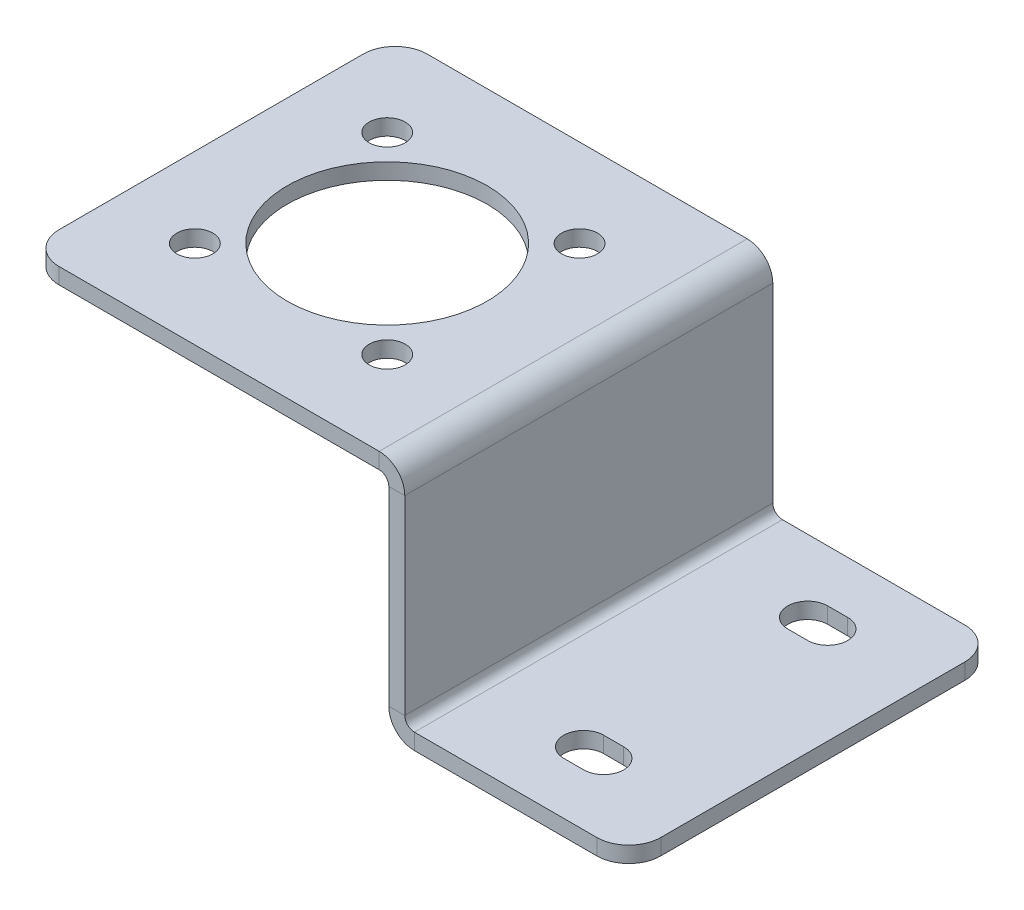
from build123d import *

# Parameters (mm, degrees)
SKETCH1_W          = 44
SKETCH1_H          = 46
SKETCH1_R          = 12.5
SKETCH1_R_2        = 2.25
BASE_FLANGE1_DEPTH = 2
EDGE_FLANGE1_DEPTH = 46
EDGE_FLANGE2_DEPTH = 46
CUT_EXTRUDE1_DEPTH = 2
FILLET1_R          = 4


# Sheet-metal steps are written as plain solids
with BuildPart() as part:
    # Sketch1 → Base-Flange1 (new body)
    with BuildSketch(Plane(origin=(0, 0, 0), x_dir=(1, 0, 0), z_dir=(0, 1, 0))):
        Rectangle(SKETCH1_W, SKETCH1_H)
        with Locations(Location((0, 0, 0), (0, 0, 270))):
            Circle(SKETCH1_R, mode=Mode.SUBTRACT)
        with Locations(Location((12.02081528, 12.02081528, 0), (0, 0, 270))):
            Circle(SKETCH1_R_2, mode=Mode.SUBTRACT)
        with Locations(Location((12.02081528, -12.02081528, 0), (0, 0, 270))):
            Circle(SKETCH1_R_2, mode=Mode.SUBTRACT)
        with Locations(Location((-12.02081528, -12.02081528, 0), (0, 0, 270))):
            Circle(SKETCH1_R_2, mode=Mode.SUBTRACT)
        with Locations(Location((-12.02081528, 12.02081528, 0), (0, 0, 270))):
            Circle(SKETCH1_R_2, mode=Mode.SUBTRACT)
    extrude(amount=-BASE_FLANGE1_DEPTH)

    # Edge-Flange1 section (across the edge) → Edge-Flange1 (add)
    with BuildSketch(Plane(origin=(23.2, -2, -23), x_dir=(-1, 0, 0), z_dir=(0, 0, 1))):
        with BuildLine():
            Line((-2, 1.2), (-2, 25))
            Line((-2, 25), (0, 25))
            Line((0, 25), (0, 1.2))
            ThreePointArc((0, 1.2), (0.351471863, 0.351471863), (1.2, 0))
            Line((1.2, 0), (1.2, -2))
            ThreePointArc((1.2, -2), (-1.0627417, -1.0627417), (-2, 1.2))
        make_face()
    extrude(amount=EDGE_FLANGE1_DEPTH)

    # Edge-Flange2 section (across the edge) → Edge-Flange2 (add)
    with BuildSketch(Plane(origin=(25.2, -28.2, 23), x_dir=(0, 1, 0), z_dir=(0, 0, -1))):
        with BuildLine():
            Line((-2, 1.2), (-2, 28))
            Line((-2, 28), (0, 28))
            Line((0, 28), (0, 1.2))
            ThreePointArc((0, 1.2), (0.351471863, 0.351471863), (1.2, 0))
            Line((1.2, 0), (1.2, -2))
            ThreePointArc((1.2, -2), (-1.0627417, -1.0627417), (-2, 1.2))
        make_face()
    extrude(amount=EDGE_FLANGE2_DEPTH)

    # Sketch12 → Cut-Extrude1 (cut)
    with BuildSketch(Plane(origin=(0, -28.2, 0), x_dir=(1, 0, 0), z_dir=(0, 1, 0))):
        with BuildLine():
            Line((38.561884659, 16.5), (41.061884659, 16.5))
            ThreePointArc((41.061884659, 16.5), (43.561884659, 14), (41.061884659, 11.5))
            Line((41.061884659, 11.5), (38.561884659, 11.5))
            ThreePointArc((38.561884659, 11.5), (36.061884659, 14), (38.561884659, 16.5))
        make_face()
        with BuildLine():
            Line((38.561884659, -16.5), (41.061884659, -16.5))
            ThreePointArc((41.061884659, -16.5), (43.561884659, -14), (41.061884659, -11.5))
            Line((41.061884659, -11.5), (38.561884659, -11.5))
            ThreePointArc((38.561884659, -11.5), (36.061884659, -14), (38.561884659, -16.5))
        make_face()
    extrude(amount=-CUT_EXTRUDE1_DEPTH, mode=Mode.SUBTRACT)

    # Fillet1
    fillet1_edges = [part.edges().sort_by_distance(p)[0] for p in [
        (53.2, -29.2, 23),
        (53.2, -29.2, -23),
        (-22, -1, 23),
        (-22, -1, -23),
    ]]
    fillet(fillet1_edges, radius=FILLET1_R)


solid = part.part
